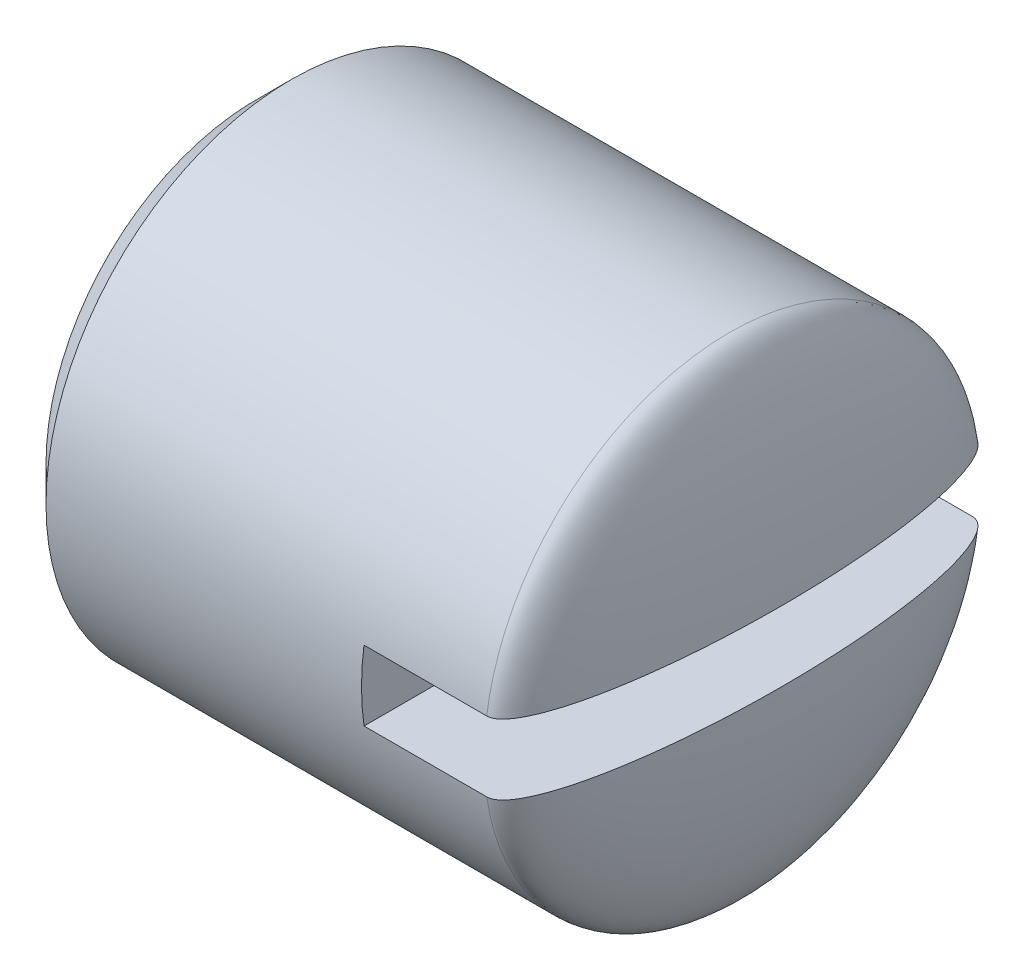
from build123d import *

# Parameters (mm, degrees)
SKETCH1_R               = 7
BOSS_EXTRUDE1_DEPTH     = 15
CHAMFER1_SIZE           = 1
FILLET1_SIZE            = 1.5
FILLET1_SIZE_2          = 6.99
CUT_EXTRUDE1_DEPTH      = 18.972200834
CUT_EXTRUDE1_DEPTH_BACK = 18.972200834
SKETCH3_W               = 5
SKETCH3_H               = 2


with BuildPart() as part:
    # Sketch1 → Boss-Extrude1 (new body)
    with BuildSketch(Plane(origin=(0, 0, 0), x_dir=(0, 0, -1), z_dir=(1, 0, 0))):
        Circle(SKETCH1_R)
    extrude(amount=-BOSS_EXTRUDE1_DEPTH)

    # Chamfer1
    chamfer1_edges = [part.edges().sort_by_distance(p)[0] for p in [
        (-15, 0, 7),
    ]]
    chamfer(chamfer1_edges, length=CHAMFER1_SIZE)

    # Fillet1
    # an asymmetric fillet: 6.99, 1.5 mm, written as the material it takes off along each edge
    with BuildSketch(Plane(origin=(0, 0, 0), x_dir=(0, 0, -1), z_dir=(0, -1, 0))) as fillet1_piece_1:
        with BuildLine():
            Bezier((7, -FILLET1_SIZE), (7, 0), (7 - FILLET1_SIZE_2, 0), weights=[1, 0.707106781, 1])
            Line((7 - FILLET1_SIZE_2, 0), (7, 0))
            Line((7, 0), (7, -FILLET1_SIZE))
        make_face()
    revolve(axis=Axis((0, 0, 0), (1, 0, 0)), mode=Mode.SUBTRACT)

    # Sketch3 → Cut-Extrude1 (cut, two sides: drawn at the far end of the back side and taken through both)
    with BuildSketch(Plane.XY.offset(-CUT_EXTRUDE1_DEPTH_BACK)):
        with Locations((-2.5, -0.01)):
            Rectangle(SKETCH3_W, SKETCH3_H)
    extrude(amount=CUT_EXTRUDE1_DEPTH + CUT_EXTRUDE1_DEPTH_BACK, mode=Mode.SUBTRACT)


solid = part.part
